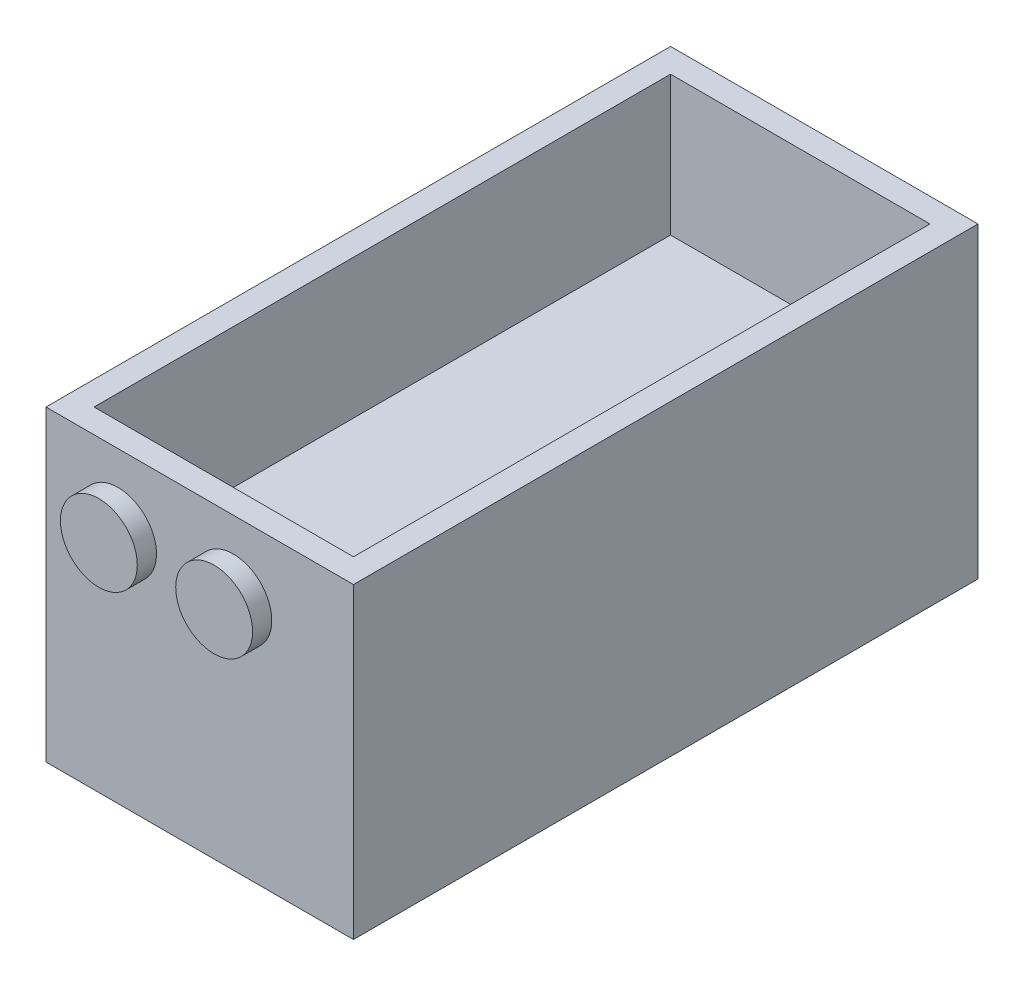
from build123d import *

# Parameters (mm, degrees)
SKETCH1_W                 = 32
SKETCH1_H                 = 65
BOSS_EXTRUDE1_DEPTH       = 32
SHELL1_T                  = -2.5
SHELL1_THICKNESS_2_FACE_W = 60
SHELL1_THICKNESS_2_FACE_H = 27
SHELL1_THICKNESS_2_DEPTH  = 15
SHELL2_START              = 2.5
SHELL2_OUTLINE_W          = 15
SHELL2_OUTLINE_H          = 60
SHELL2_DEPTH              = 27
SKETCH2_R                 = 4
BOSS_EXTRUDE2_DEPTH       = 2


# Read off the part's stored shape, not the designer's step: Shell2
with BuildPart() as part:
    # Sketch1 → Boss-Extrude1 (new body)
    with BuildSketch(Plane(origin=(0, 0, 0), x_dir=(1, 0, 0), z_dir=(0, 1, 0))):
        with Locations((16, -32.5)):
            Rectangle(SKETCH1_W, SKETCH1_H)
    extrude(amount=BOSS_EXTRUDE1_DEPTH)

    # Shell1
    shell1_openings = [part.faces().sort_by_distance(p)[0] for p in [
        (16, 32, 32.5),
    ]]
    offset(amount=SHELL1_T, openings=shell1_openings, kind=Kind.INTERSECTION)

    # Shell1 thickness 2 face (on inner face of the shell) → Shell1 thickness 2 (add)
    with BuildSketch(Plane(origin=(16, 2.5, 32.5), x_dir=(0, 0, -1), z_dir=(0, -1, 0))):
        Rectangle(SHELL1_THICKNESS_2_FACE_W, SHELL1_THICKNESS_2_FACE_H)
    extrude(amount=-SHELL1_THICKNESS_2_DEPTH)

    # Shell2 outline → Shell2 (cut)
    with BuildSketch(Plane.YZ.offset(SHELL2_START)):
        with Locations((7.5, 32.5)):
            Rectangle(SHELL2_OUTLINE_W, SHELL2_OUTLINE_H)
    extrude(amount=SHELL2_DEPTH, mode=Mode.SUBTRACT)

    # Sketch2 → Boss-Extrude2 (add)
    with BuildSketch(Plane.XY.offset(65)):
        with Locations(Location((7.5, 24.5, 0), (0, 0, 180))):
            Circle(SKETCH2_R)
        with Locations(Location((19.5, 24.5, 0), (0, 0, 180))):
            Circle(SKETCH2_R)
    extrude(amount=BOSS_EXTRUDE2_DEPTH)


solid = part.part
